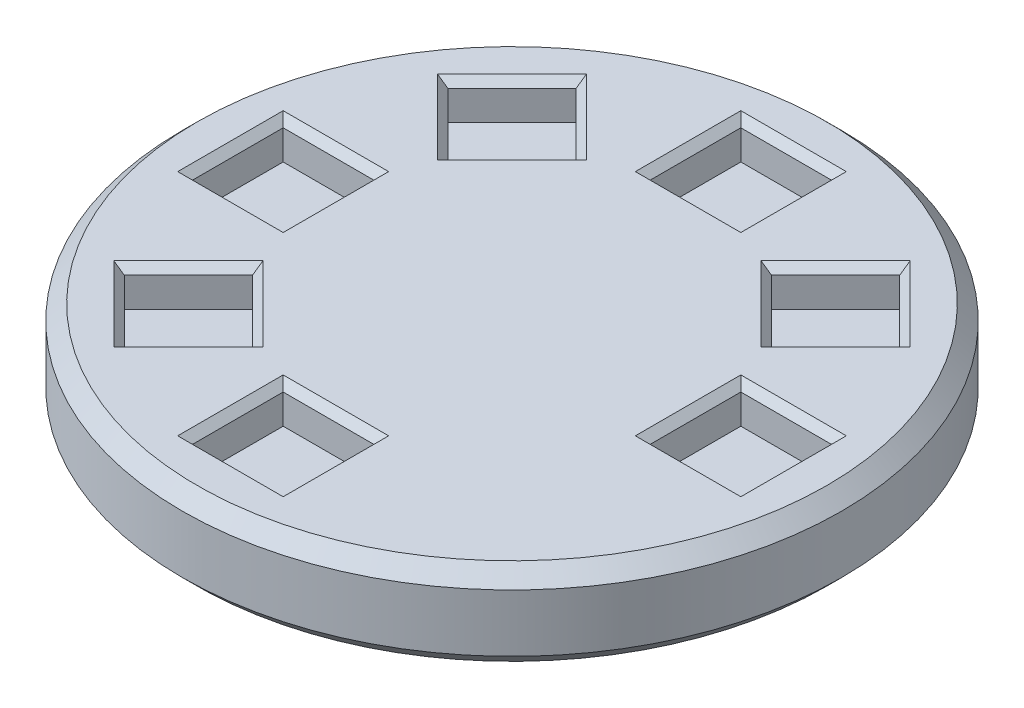
from build123d import *

# Parameters (mm, degrees)
SKETCH3_W                    = 12.25
SKETCH3_H                    = 12.25
CUT_EXTRUDE1_DEPTH           = 5
CHAMFER1_SIZE                = 1
CIRPATTERN1_COUNT            = 8
CHAMFER1_OF_CIRPATTERN1_SIZE = 1
CHAMFER2_SIZE                = 2
CHAMFER3_SIZE                = 2


with BuildPart() as part:
    # Sketch1 → Revolve1 (revolve)
    with BuildSketch(Plane.XY):
        Polygon((0, -32.346067293), (9.202151472, -32.346067293), (9.202151472, -11.766555681), (44.538510537, -11.766555681), (44.538510537, 0), (0, 0), align=None)
    revolve(axis=Axis((0, -2049.571576157, 0), (0, 1, 0)))

    # Sketch3 → Cut-Extrude1 (cut)
    with BuildSketch(Plane(origin=(0, 0, 0), x_dir=(1, 0, 0), z_dir=(0, 1, 0))):
        with Locations((30.911278103, 0)):
            Rectangle(SKETCH3_W, SKETCH3_H)
    cut_extrude1 = extrude(amount=-CUT_EXTRUDE1_DEPTH, mode=Mode.SUBTRACT)

    # Chamfer1
    chamfer1_edges = [part.edges().sort_by_distance(p)[0] for p in [
        (37.036278103, 0, 0),
        (30.911278103, 0, 6.125),
        (24.786278103, 0, 0),
        (30.911278103, 0, -6.125),
    ]]
    chamfer(chamfer1_edges, length=CHAMFER1_SIZE)

    # CirPattern1: Cut-Extrude1 ×8 about axis, 1 skipped
    cirpattern1_axis = Axis((0, -2049.571576157, 0), (0, 1, 0))
    add([cut_extrude1.rotate(cirpattern1_axis, i * 360 / CIRPATTERN1_COUNT) for i in range(1, CIRPATTERN1_COUNT) if i not in (7,)], mode=Mode.SUBTRACT)

    # Chamfer1 of CirPattern1
    chamfer1_of_cirpattern1_edges = [part.edges().sort_by_distance(p)[0] for p in [
        (26.188603397, 0, -26.188603397),
        (26.188603397, 0, -17.526545327),
        (17.526545327, 0, -17.526545327),
        (17.526545327, 0, -26.188603397),
        (0, 0, -37.036278103),
        (6.125, 0, -30.911278103),
        (0, 0, -24.786278103),
        (-6.125, 0, -30.911278103),
        (-26.188603397, 0, -26.188603397),
        (-17.526545327, 0, -26.188603397),
        (-17.526545327, 0, -17.526545327),
        (-26.188603397, 0, -17.526545327),
        (-37.036278103, 0, 0),
        (-30.911278103, 0, -6.125),
        (-24.786278103, 0, 0),
        (-30.911278103, 0, 6.125),
        (-26.188603397, 0, 26.188603397),
        (-26.188603397, 0, 17.526545327),
        (-17.526545327, 0, 17.526545327),
        (-17.526545327, 0, 26.188603397),
        (0, 0, 37.036278103),
        (-6.125, 0, 30.911278103),
        (0, 0, 24.786278103),
        (6.125, 0, 30.911278103),
    ]]
    chamfer(chamfer1_of_cirpattern1_edges, length=CHAMFER1_OF_CIRPATTERN1_SIZE)

    # Chamfer2
    chamfer2_edges = [part.edges().sort_by_distance(p)[0] for p in [
        (-9.202151472, -32.346067293, 0),
    ]]
    chamfer(chamfer2_edges, length=CHAMFER2_SIZE)

    # Chamfer3
    chamfer3_edges = [part.edges().sort_by_distance(p)[0] for p in [
        (-44.538510537, -11.766555681, 0),
        (-44.538510537, 0, 0),
    ]]
    chamfer(chamfer3_edges, length=CHAMFER3_SIZE)


solid = part.part
